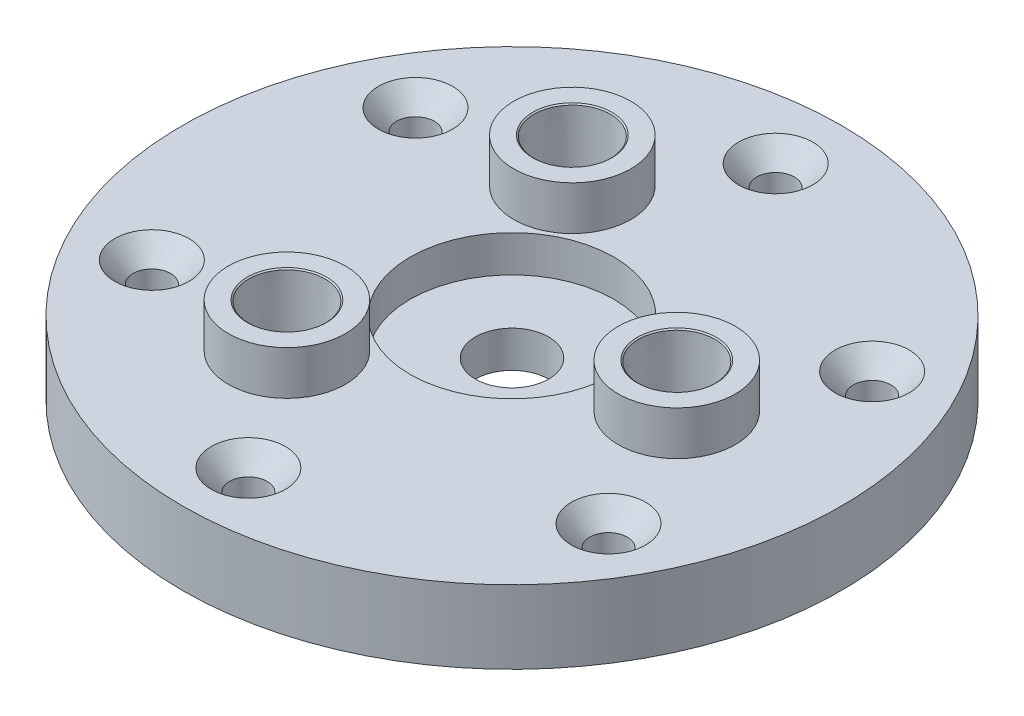
from build123d import *

# Parameters (mm, degrees)
SKETCH1_R                                        = 57.15
BOSS_EXTRUDE1_DEPTH                              = 6.35
CUT_EXTRUDE1_DEPTH                               = 82.071372876
CUT_EXTRUDE1_DEPTH_BACK                          = 82.071372876
SKETCH2_R                                        = 6.35
SKETCH3_R                                        = 57.15
SKETCH3_R_2                                      = 17.653
BOSS_EXTRUDE2_DEPTH                              = 6.35
CUT_EXTRUDE2_DEPTH                               = 82.814026915
CUT_EXTRUDE2_DEPTH_BACK                          = 82.814026915
SKETCH4_R                                        = 3.175
CSK_FOR_1_4_FLAT_HEAD_MACHINE_SCREW1_D           = 6.5278
CSK_FOR_1_4_FLAT_HEAD_MACHINE_SCREW1_CSINK_D     = 12.8778
CSK_FOR_1_4_FLAT_HEAD_MACHINE_SCREW1_CSINK_ANGLE = 82
CIRPATTERN1_COUNT                                = 6
BOSS_EXTRUDE3_START                              = 7.62
SKETCH11_R                                       = 10.16
SKETCH11_R_2                                     = 3.175
BOSS_EXTRUDE3_DEPTH                              = 7.62
F_1_4_NPT_TAPPED_HOLE3_AT_2_COUNT                = 2
F_1_4_NPT_TAPPED_HOLE3_AT_2_PITCH                = 49.493351826
F_1_4_NPT_TAPPED_HOLE3_AT_3_COUNT                = 2
F_1_4_NPT_TAPPED_HOLE3_AT_3_PITCH                = 49.493351826


with BuildPart() as part:
    # Sketch1 → Boss-Extrude1 (new body)
    with BuildSketch(Plane(origin=(0, 0, 0), x_dir=(1, 0, 0), z_dir=(0, 1, 0))):
        Circle(SKETCH1_R)
    extrude(amount=BOSS_EXTRUDE1_DEPTH)

    # Sketch2 → Cut-Extrude1 (cut, two sides: drawn at the far end of the back side and taken through both)
    with BuildSketch(Plane(origin=(0, 6.35, 0), x_dir=(1, 0, 0), z_dir=(0, 1, 0)).offset(-CUT_EXTRUDE1_DEPTH_BACK)):
        Circle(SKETCH2_R)
    extrude(amount=CUT_EXTRUDE1_DEPTH + CUT_EXTRUDE1_DEPTH_BACK, mode=Mode.SUBTRACT)

    # Sketch3 → Boss-Extrude2 (add)
    with BuildSketch(Plane(origin=(0, 6.35, 0), x_dir=(1, 0, 0), z_dir=(0, 1, 0))):
        Circle(SKETCH3_R)
        Circle(SKETCH3_R_2, mode=Mode.SUBTRACT)
    extrude(amount=BOSS_EXTRUDE2_DEPTH)

    # Sketch4 → Cut-Extrude2 (cut, two sides: drawn at the far end of the back side and taken through both)
    with BuildSketch(Plane(origin=(0, 12.7, 0), x_dir=(1, 0, 0), z_dir=(0, 1, 0)).offset(-CUT_EXTRUDE2_DEPTH_BACK)):
        with Locations((28.575, 0)):
            Circle(SKETCH4_R)
        with Locations((-14.2875, -24.746675913)):
            Circle(SKETCH4_R)
        with Locations((-14.2875, 24.746675913)):
            Circle(SKETCH4_R)
    extrude(amount=CUT_EXTRUDE2_DEPTH + CUT_EXTRUDE2_DEPTH_BACK, mode=Mode.SUBTRACT)

    # CSK for 1/4 Flat Head Machine Screw1 (through all)
    with Locations(Plane(origin=(0, 12.7, -45.72), x_dir=(0, 0, 1), z_dir=(0, 1, 0))):
        with Locations((0, 0)):
            csk_for_1_4_flat_head_machine_screw1 = CounterSinkHole(CSK_FOR_1_4_FLAT_HEAD_MACHINE_SCREW1_D / 2, CSK_FOR_1_4_FLAT_HEAD_MACHINE_SCREW1_CSINK_D / 2, counter_sink_angle=CSK_FOR_1_4_FLAT_HEAD_MACHINE_SCREW1_CSINK_ANGLE)

    # CirPattern1: CSK for 1/4 Flat Head Machine Screw1 ×6 about axis
    cirpattern1_axis = Axis((0, 6.35, 0), (0, 1, 0))
    for i in range(1, CIRPATTERN1_COUNT):
        add(csk_for_1_4_flat_head_machine_screw1.rotate(cirpattern1_axis, i * 360 / CIRPATTERN1_COUNT), mode=Mode.SUBTRACT)

    # Sketch11 → Boss-Extrude3 (add)
    # profile 1 of 3: a face of its own
    with BuildSketch(Plane(origin=(0, 12.7, 0), x_dir=(1, 0, 0), z_dir=(0, 1, 0)).offset(BOSS_EXTRUDE3_START)):
        with Locations((-14.2875, 24.746675913)):
            Circle(SKETCH11_R)
        with Locations((-14.2875, 24.746675913)):
            Circle(SKETCH11_R_2, mode=Mode.SUBTRACT)
    # profile 2 of 3: a face of its own
    with BuildSketch(Plane(origin=(0, 12.7, 0), x_dir=(1, 0, 0), z_dir=(0, 1, 0)).offset(BOSS_EXTRUDE3_START)):
        with Locations((28.575, 0)):
            Circle(SKETCH11_R)
        with Locations((28.575, 0)):
            Circle(SKETCH11_R_2, mode=Mode.SUBTRACT)
    # profile 3 of 3: a face of its own
    with BuildSketch(Plane(origin=(0, 12.7, 0), x_dir=(1, 0, 0), z_dir=(0, 1, 0)).offset(BOSS_EXTRUDE3_START)):
        with Locations((-14.2875, -24.746675913)):
            Circle(SKETCH11_R)
        with Locations((-14.2875, -24.746675913)):
            Circle(SKETCH11_R_2, mode=Mode.SUBTRACT)
    extrude(amount=-BOSS_EXTRUDE3_DEPTH)

    # Sketch13 → 1/4 NPT Tapped Hole3 (revolve, cut)
    with BuildSketch(Plane(origin=(-14.2875, 20.32, -24.746675913), x_dir=(0, 0, 1), z_dir=(1, 0, 0))):
        Polygon((0, 0), (0, 20.411147279), (5.5626, 17.0688), (5.5626, 10.0203), (6.335555425, 10.0203), (6.6298445, 0.191445196), (6.858, 0), align=None)
    f_1_4_npt_tapped_hole3 = revolve(axis=Axis((-14.2875, 26.67, -24.746675913), (0, -1, 0)), mode=Mode.SUBTRACT)

    # 1/4 NPT Tapped Hole3 at 2: 1/4 NPT Tapped Hole3 ×2
    with Locations(*[Vector(0.8660254037844387, 0, 0.49999999999999983) * (i * F_1_4_NPT_TAPPED_HOLE3_AT_2_PITCH) for i in range(1, F_1_4_NPT_TAPPED_HOLE3_AT_2_COUNT)]):
        add(f_1_4_npt_tapped_hole3, mode=Mode.SUBTRACT)

    # 1/4 NPT Tapped Hole3 at 3: 1/4 NPT Tapped Hole3 ×2
    with Locations(*[(0, 0, i * F_1_4_NPT_TAPPED_HOLE3_AT_3_PITCH) for i in range(1, F_1_4_NPT_TAPPED_HOLE3_AT_3_COUNT)]):
        add(f_1_4_npt_tapped_hole3, mode=Mode.SUBTRACT)


solid = part.part
